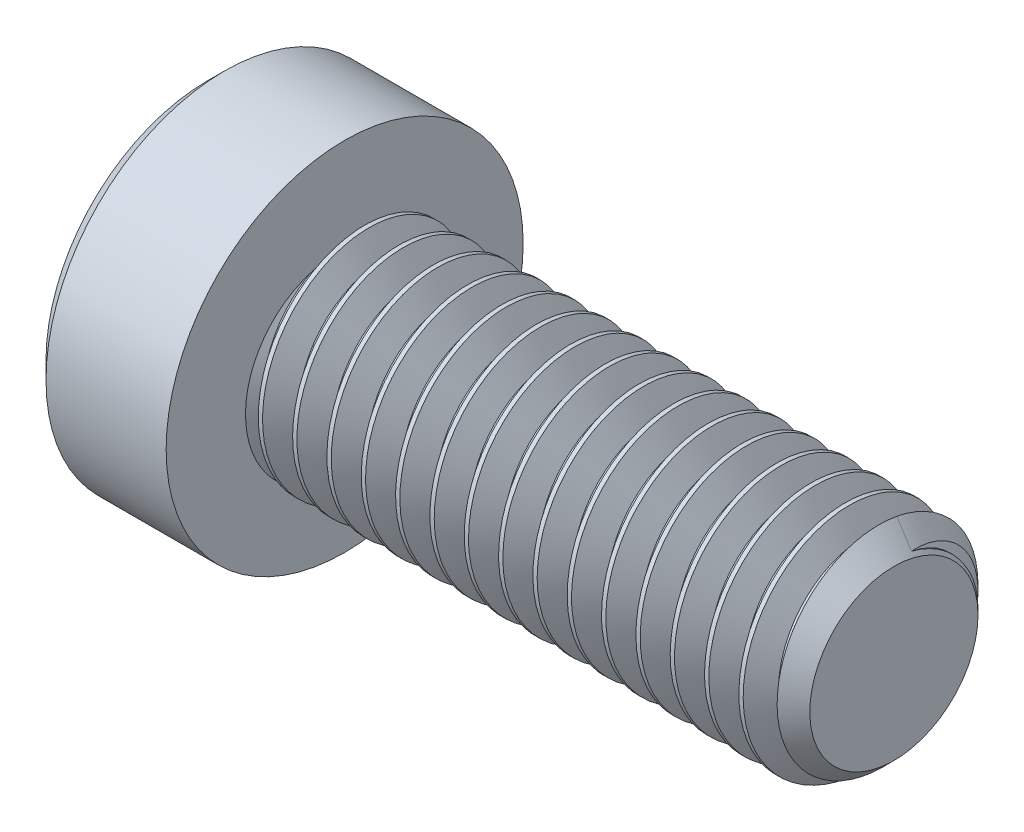
from build123d import *

# Parameters (mm, degrees)
SKETCH2_R           = 4
BOSS_EXTRUDE1_DEPTH = 20
CHAMFER1_SIZE       = 0.9375
CUT_SWEEP1_PITCH    = 1.25
CUT_EXTRUDE1_DEPTH  = 3.95


with BuildPart() as part:
    # Sketch2 → Boss-Extrude1 (new body)
    with BuildSketch(Plane(origin=(10, 0, 0), x_dir=(0, 0, -1), z_dir=(1, 0, 0))):
        Circle(SKETCH2_R)
    extrude(amount=-BOSS_EXTRUDE1_DEPTH)

    # Chamfer1
    chamfer1_edges = [part.edges().sort_by_distance(p)[0] for p in [
        (10, 0, 4),
    ]]
    chamfer(chamfer1_edges, length=CHAMFER1_SIZE)

    # Cut-Sweep1: the profile of Sketch5 profile screwed along a right-hand helix of 17 turns, 8 arcs to a turn; built about Z, then put on its axis
    cut_sweep1_z = Axis((0, 0, 0), (0, 0, 1))
    cut_sweep1_corners = [(4.0003, 0, 0.547048205), (4.0003, 0, -0.547048205), (3.188101184, 0, -0.078125), (3.188101184, 0, 0.078125)]
    with BuildLine(mode=Mode.PRIVATE) as cut_sweep1_profile:
        Line(cut_sweep1_corners[0], cut_sweep1_corners[1])
        Line(cut_sweep1_corners[1], cut_sweep1_corners[2])
        Line(cut_sweep1_corners[2], cut_sweep1_corners[3])
        Line(cut_sweep1_corners[3], cut_sweep1_corners[0])
    cut_sweep1_cap = Face(cut_sweep1_profile.wire())
    cut_sweep1_turn_angles = [0, 22.5, 45, 67.5, 90, 112.5, 135, 157.5, 180, 202.5, 225, 247.5, 270, 292.5, 315, 337.5, 360]
    cut_sweep1_turn_weights = [1, 0.9238795325112867, 1, 0.9238795325112867, 1, 0.9238795325112867, 1, 0.9238795325112867, 1, 0.9238795325112867, 1, 0.9238795325112867, 1, 0.9238795325112867, 1, 0.9238795325112867, 1]
    cut_sweep1_turn_rails = [Edge.make_bspline([Vector(p[0], p[1], 0).rotate(cut_sweep1_z, cut_sweep1_turn_angles[k]) / cut_sweep1_turn_weights[k] + Vector(0, 0, p[2] + CUT_SWEEP1_PITCH * cut_sweep1_turn_angles[k] / 360) for k in range(17)], [0, 0, 0, 1, 1, 2, 2, 3, 3, 4, 4, 5, 5, 6, 6, 7, 7, 8, 8, 8], 2, cut_sweep1_turn_weights) for p in cut_sweep1_corners]
    cut_sweep1_turn_sides = [Face.make_surface_from_curves(cut_sweep1_turn_rails[p[0]], cut_sweep1_turn_rails[p[1]]) for p in [(0, 1), (1, 2), (2, 3), (3, 0)]]
    cut_sweep1 = Plane(origin=(10, 0, 0), x_dir=(0, 1, 0), z_dir=(-1, 0, 0)) * Solid(Shell([*[p.moved(Location((0, 0, CUT_SWEEP1_PITCH * i))) for i in range(17) for p in cut_sweep1_turn_sides], cut_sweep1_cap, cut_sweep1_cap.rotate(cut_sweep1_z, 6120).moved(Location((0, 0, CUT_SWEEP1_PITCH * 6120 / 360)))]))
    add(cut_sweep1, mode=Mode.SUBTRACT)

    # Sketch6 → Revolve1 (revolve)
    with BuildSketch(Plane.XY, mode=Mode.PRIVATE) as revolve1_sk:
        Polygon((-14.375, 6.5), (-15, 5.875), (-15, 0), (-10, 0), (-10, 6.5), align=None)
    revolve(revolve1_sk.sketch.rotate(Axis((-10, 0, 0), (-1, 0, 0)), 13.865622854), axis=Axis((-10, 0, 0), (-1, 0, 0)))

    # Sketch4 → Cut-Extrude1 (cut)
    with BuildSketch(Plane(origin=(-15, 0, 0), x_dir=(0, 0, -1), z_dir=(1, 0, 0))):
        Polygon((0, 2.886751346), (-2.5, 1.443375673), (-2.5, -1.443375673), (0, -2.886751346), (2.5, -1.443375673), (2.5, 1.443375673), align=None)
    extrude(amount=CUT_EXTRUDE1_DEPTH, mode=Mode.SUBTRACT)

    # Cut-Extrude2 cone 1 section (through the dimple's axis) → Cut-Extrude2 (revolve, cut)
    with BuildSketch(Plane(origin=(-15, 0, 0), x_dir=(0, 0, 1), z_dir=(0, 1, 0))):
        Polygon((0, 0), (2.886751346, 0), (0, 2.886751346), align=None)
    revolve(axis=Axis((-15, 0, 0), (1, 0, 0)), mode=Mode.SUBTRACT)


solid = part.part
